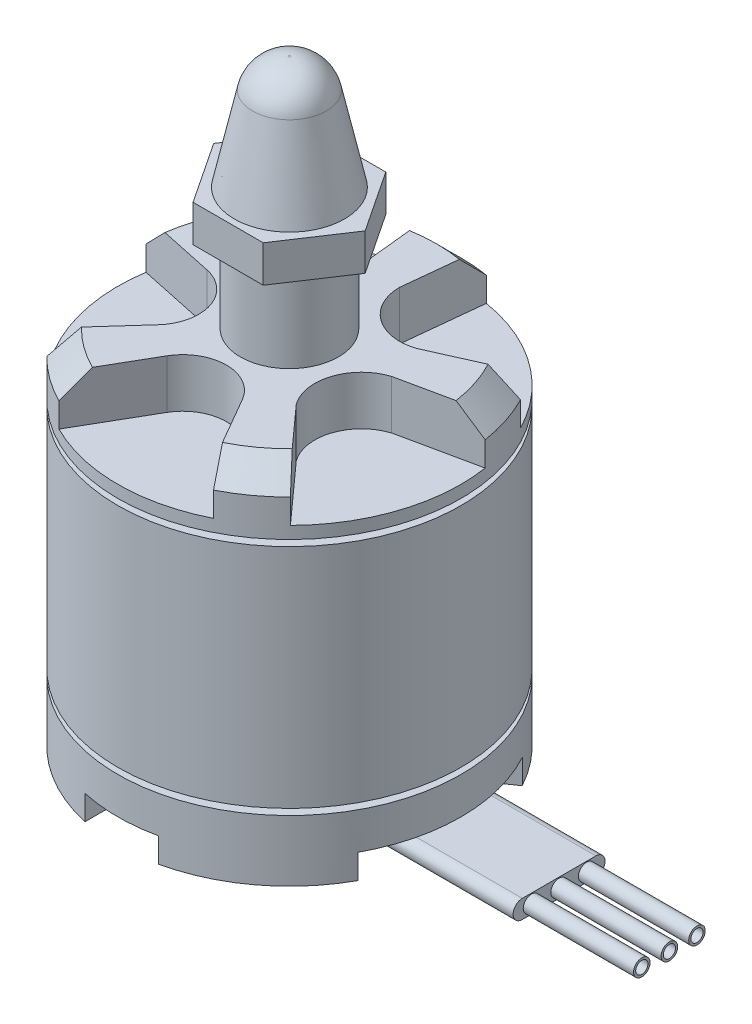
from build123d import *

# Parameters (mm, degrees)
SKETCH1_R                = 14
BOSS_EXTRUDE1_DEPTH      = 9.25
SKETCH2_R                = 12.5
BOSS_EXTRUDE2_DEPTH      = 0.5
BOSS_EXTRUDE3_START      = 0.5
SKETCH3_R                = 12.5
BOSS_EXTRUDE3_DEPTH      = 0.5
SKETCH4_R                = 14
BOSS_EXTRUDE4_DEPTH      = 5
BOSS_EXTRUDE5_START      = 1
SKETCH5_R                = 14
BOSS_EXTRUDE5_DEPTH      = 1
BOSS_EXTRUDE6_START      = 4
SKETCH6_R                = 4
BOSS_EXTRUDE6_DEPTH      = 4
BOSS_EXTRUDE7_START      = 11
SKETCH7_R                = 4
BOSS_EXTRUDE7_DEPTH      = 11
FILLET4_SIZE             = 2
BOSS_EXTRUDE8_DEPTH      = 3
SKETCH10_R               = 4.5
SKETCH9_R                = 2.5
FILLET5_R                = 3
CUT_EXTRUDE1_START       = -2
CUT_EXTRUDE1_DEPTH       = 2
BOSS_EXTRUDE9_DEPTH      = 8
BOSS_EXTRUDE9_DEPTH_BACK = 17
SKETCH16_R               = 0.675
BOSS_EXTRUDE10_DEPTH     = 9
SKETCH18_R               = 0.5
CUT_EXTRUDE2_DEPTH       = 9
SCALE1_SCALE             = 2
SKETCH19_R               = 19.428126758
CUT_EXTRUDE3_DEPTH       = 35


with BuildPart() as part:
    # Sketch1 → Boss-Extrude1 (new, symmetric)
    with BuildSketch(Plane(origin=(0, 0, 0), x_dir=(1, 0, 0), z_dir=(0, 1, 0))):
        with Locations(Location((0, 0, 0), (0, 0, 270))):
            Circle(SKETCH1_R)
    extrude(amount=BOSS_EXTRUDE1_DEPTH, both=True)

    # Sketch2 → Boss-Extrude2 (add)
    with BuildSketch(Plane(origin=(0, 9.25, 0), x_dir=(1, 0, 0), z_dir=(0, 1, 0))):
        with Locations(Location((0, 0, 0), (0, 0, 270))):
            Circle(SKETCH2_R)
    extrude(amount=BOSS_EXTRUDE2_DEPTH)

    # Sketch3 → Boss-Extrude3 (add)
    with BuildSketch(Plane.XZ.offset(9.25).offset(BOSS_EXTRUDE3_START)):
        with Locations(Location((0, 0, 0), (0, 0, 90))):
            Circle(SKETCH3_R)
    extrude(amount=-BOSS_EXTRUDE3_DEPTH)

    # Sketch4 → Boss-Extrude4 (add)
    with BuildSketch(Plane.XZ.offset(9.75)):
        with Locations(Location((0, 0, 0), (0, 0, 90))):
            Circle(SKETCH4_R)
    extrude(amount=BOSS_EXTRUDE4_DEPTH)

    # Sketch5 → Boss-Extrude5 (add)
    with BuildSketch(Plane(origin=(0, 9.75, 0), x_dir=(1, 0, 0), z_dir=(0, 1, 0)).offset(BOSS_EXTRUDE5_START)):
        with Locations(Location((0, 0, 0), (0, 0, 270))):
            Circle(SKETCH5_R)
    extrude(amount=-BOSS_EXTRUDE5_DEPTH)

    # Sketch6 → Boss-Extrude6 (add)
    with BuildSketch(Plane(origin=(0, 10.75, 0), x_dir=(1, 0, 0), z_dir=(0, 1, 0)).offset(BOSS_EXTRUDE6_START)):
        with BuildLine():
            ThreePointArc((6.560632788, 3.783884599), (3.142489225, 4.325265354), (1.571341079, 7.408817209))
            Line((1.571341079, 7.408817209), (2.245059227, 13.818817209))
            ThreePointArc((2.245059227, 13.818817209), (0, 14), (-2.245059227, 13.818817209))
            Line((-2.245059227, 13.818817209), (-1.571341079, 7.408817209))
            ThreePointArc((-1.571341079, 7.408817209), (-3.019559024, 4.156066449), (-6.560632788, 3.783884599))
            Line((-6.560632788, 3.783884599), (-12.4487147, 6.405427568))
            ThreePointArc((-12.4487147, 6.405427568), (-13.314791228, 4.326237921), (-13.836237609, 2.135071152))
            Line((-13.836237609, 2.135071152), (-7.531774982, 0.795016253))
            ThreePointArc((-7.531774982, 0.795016253), (-4.885749132, -1.587476124), (-5.62603513, -5.070247918))
            Line((-5.62603513, -5.070247918), (-9.938788028, -9.86004526))
            ThreePointArc((-9.938788028, -9.86004526), (-8.228993532, -11.326237921), (-6.306205891, -12.499270669))
            Line((-6.306205891, -12.499270669), (-3.083551855, -6.917470143))
            ThreePointArc((-3.083551855, -6.917470143), (0, -5.13718065), (3.083551855, -6.917470143))
            Line((3.083551855, -6.917470143), (6.306205891, -12.499270669))
            ThreePointArc((6.306205891, -12.499270669), (8.228993532, -11.326237921), (9.938788028, -9.86004526))
            Line((9.938788028, -9.86004526), (5.62603513, -5.070247918))
            ThreePointArc((5.62603513, -5.070247918), (5.084654375, -1.652104355), (7.531774982, 0.795016253))
            Line((7.531774982, 0.795016253), (13.836237609, 2.135071152))
            ThreePointArc((13.836237609, 2.135071152), (13.314791228, 4.326237921), (12.4487147, 6.405427568))
            Line((12.4487147, 6.405427568), (6.560632788, 3.783884599))
        make_face()
        with Locations(Location((0, 0, 0), (0, 0, 270))):
            Circle(SKETCH6_R, mode=Mode.SUBTRACT)
    extrude(amount=-BOSS_EXTRUDE6_DEPTH)

    # Sketch7 → Boss-Extrude7 (add)
    with BuildSketch(Plane(origin=(0, 10.75, 0), x_dir=(1, 0, 0), z_dir=(0, 1, 0)).offset(BOSS_EXTRUDE7_START)):
        with Locations(Location((0, 0, 0), (0, 0, 270))):
            Circle(SKETCH7_R)
    extrude(amount=-BOSS_EXTRUDE7_DEPTH)

    # Fillet4
    fillet4_edges = [part.edges().sort_by_distance(p)[0] for p in [
        (0, 14.75, -14),
        (-13.314791228, 14.75, -4.326237921),
        (-8.228993532, 14.75, 11.326237921),
        (8.228993532, 14.75, 11.326237921),
        (13.314791228, 14.75, -4.326237921),
    ]]
    chamfer(fillet4_edges, length=FILLET4_SIZE)

    # Sketch8 → Boss-Extrude8 (add)
    with BuildSketch(Plane(origin=(0, 21.75, 0), x_dir=(1, 0, 0), z_dir=(0, 1, 0))):
        Polygon((-2.862387208, 5), (2.862387208, 5), (6.179011998, 0), (2.862387208, -5), (-2.862387208, -5), (-6.179011998, 0), align=None)
    extrude(amount=BOSS_EXTRUDE8_DEPTH)

    # Sketch10 → Loft1 section 0
    with BuildSketch(Plane(origin=(0, 24.75, 0), x_dir=(1, 0, 0), z_dir=(0, 1, 0))):
        Circle(SKETCH10_R)
    # Sketch9 → Loft1 section 1
    with BuildSketch(Plane(origin=(0, 34, 0), x_dir=(1, 0, 0), z_dir=(0, 1, 0))):
        Circle(SKETCH9_R)
    loft()

    # Fillet5
    fillet5_edges = [part.edges().sort_by_distance(p)[0] for p in [
        (-2.5, 34, 0),
    ]]
    fillet(fillet5_edges, radius=FILLET5_R)

    # Sketch12 → Cut-Extrude1 (cut)
    with BuildSketch(Plane.XZ.offset(14.75).offset(CUT_EXTRUDE1_START)):
        with BuildLine():
            ThreePointArc((3, 13.674794331), (0, 14), (-3, 13.674794331))
            Line((-3, 13.674794331), (-3, 8))
            ThreePointArc((-3, 8), (0, 5), (3, 8))
            Line((3, 8), (3, 13.674794331))
        make_face()
        with BuildLine():
            Line((-8, 3), (-13.674794331, 3))
            ThreePointArc((-13.674794331, 3), (-14, 0), (-13.674794331, -3))
            Line((-13.674794331, -3), (-8, -3))
            ThreePointArc((-8, -3), (-5, 0), (-8, 3))
        make_face()
        with BuildLine():
            Line((12.289759461, 6.705356992), (6.260800415, 2.483834421))
            ThreePointArc((6.260800415, 2.483834421), (4.967798056, 0), (6.260800415, -2.483834421))
            Line((6.260800415, -2.483834421), (12.289759461, -6.705356992))
            ThreePointArc((12.289759461, -6.705356992), (14, 0), (12.289759461, 6.705356992))
        make_face()
        with BuildLine():
            Line((-3, -8), (-3, -13.674794331))
            ThreePointArc((-3, -13.674794331), (0, -14), (3, -13.674794331))
            Line((3, -13.674794331), (3, -8))
            ThreePointArc((3, -8), (0, -5), (-3, -8))
        make_face()
    extrude(amount=CUT_EXTRUDE1_DEPTH, mode=Mode.SUBTRACT)

    # Sketch14 → Boss-Extrude9 (add, two sides: drawn at the far end of the back side and taken through both)
    with BuildSketch(Plane(origin=(14, 0, 0), x_dir=(0, 0, -1), z_dir=(1, 0, 0)).offset(-BOSS_EXTRUDE9_DEPTH_BACK)):
        with BuildLine():
            Line((-3, -13), (3, -13))
            ThreePointArc((3, -13), (3.75, -13.75), (3, -14.5))
            Line((3, -14.5), (-3, -14.5))
            ThreePointArc((-3, -14.5), (-3.75, -13.75), (-3, -13))
        make_face()
    extrude(amount=BOSS_EXTRUDE9_DEPTH + BOSS_EXTRUDE9_DEPTH_BACK)

    # Sketch16 → Boss-Extrude10 (add)
    with BuildSketch(Plane(origin=(22, 0, 0), x_dir=(0, 0, -1), z_dir=(1, 0, 0))):
        with Locations((-2.25, -13.75)):
            Circle(SKETCH16_R)
        with Locations((0, -13.75)):
            Circle(SKETCH16_R)
        with Locations((2.25, -13.75)):
            Circle(SKETCH16_R)
    extrude(amount=BOSS_EXTRUDE10_DEPTH)

    # Sketch18 → Cut-Extrude2 (cut)
    with BuildSketch(Plane(origin=(31, 0, 0), x_dir=(0, 0, -1), z_dir=(1, 0, 0))):
        with Locations((-2.25, -13.75)):
            Circle(SKETCH18_R)
        with Locations((2.25, -13.75)):
            Circle(SKETCH18_R)
        with Locations((0, -13.75)):
            Circle(SKETCH18_R)
    extrude(amount=-CUT_EXTRUDE2_DEPTH, mode=Mode.SUBTRACT)


with BuildPart() as part_1:
    # Scale1: scaled about (0.135762453, 0.409238593, -0.000649103)
    add(part.part.scale(SCALE1_SCALE).moved(Location((-0.135762453, -0.409238593, 0.000649103))))

    # Sketch19 → Cut-Extrude3 (cut)
    with BuildSketch(Plane.XZ.offset(18.90923893)):
        with Locations(Location((0, 0, 0), (0, 0, 270))):
            Circle(SKETCH19_R)
    extrude(amount=-CUT_EXTRUDE3_DEPTH, mode=Mode.SUBTRACT)


solid = part_1.part
